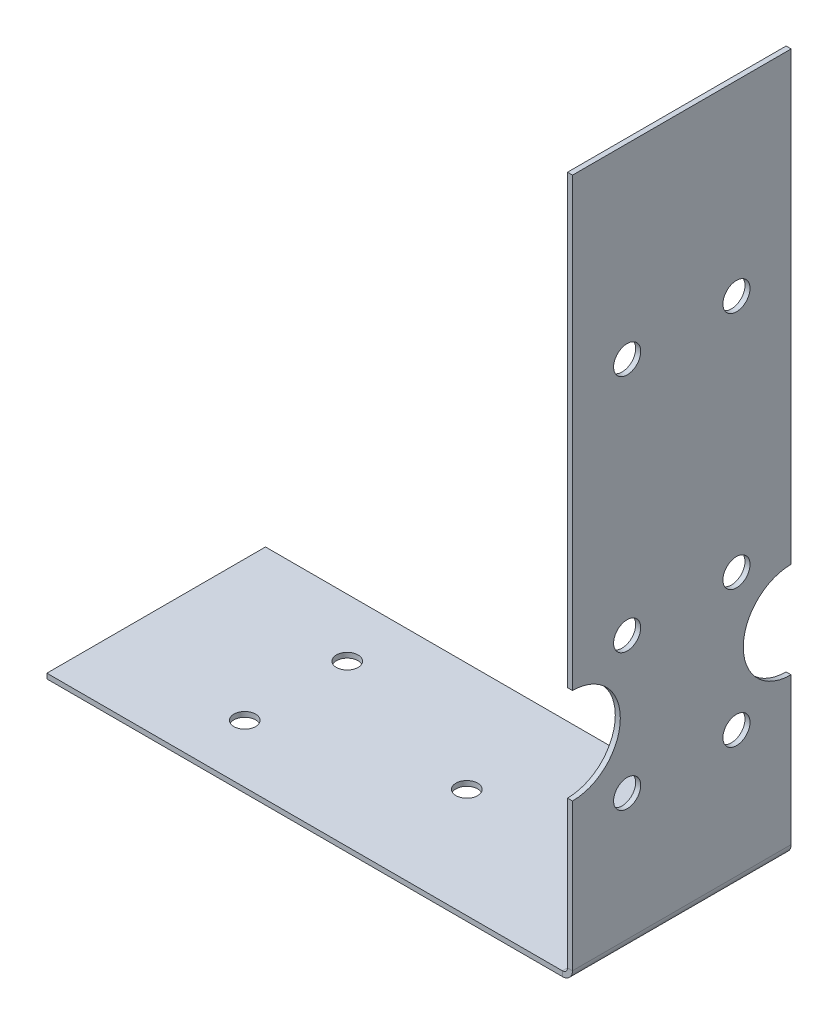
from build123d import *

# Parameters (mm, degrees)
BASE_FLANGE1_DEPTH = 16
SKETCH6_R          = 7
SKETCH6_R_2        = 1.984375
CUT_EXTRUDE1_DEPTH = 10
SKETCH7_R          = 1.5875
CUT_EXTRUDE2_DEPTH = 10


# Sheet-metal steps are written as plain solids
with BuildPart() as part:
    # Sketch1 → Base-Flange1 (new, symmetric)
    with BuildSketch(Plane.XY):
        with BuildLine():
            Line((-76.2, 0), (-0.7366, 0))
            ThreePointArc((-0.7366, 0), (-0.215745145, 0.215745145), (0, 0.7366))
            Line((0, 0.7366), (0, 101.6))
            Line((0, 101.6), (0.7366, 101.6))
            Line((0.7366, 101.6), (0.7366, 0.7366))
            ThreePointArc((0.7366, 0.7366), (0.30510971, -0.30510971), (-0.7366, -0.7366))
            Line((-0.7366, -0.7366), (-76.2, -0.7366))
            Line((-76.2, -0.7366), (-76.2, 0))
        make_face()
    extrude(amount=BASE_FLANGE1_DEPTH, both=True)

    # Sketch6 → Cut-Extrude1 (cut)
    with BuildSketch(Plane.ZY):
        with Locations((16, 29.2634)):
            Circle(SKETCH6_R)
        with Locations((8, 19.2634)):
            Circle(SKETCH6_R_2)
        with Locations((8, 39.2634)):
            Circle(SKETCH6_R_2)
        with Locations((8, 74.2634)):
            Circle(SKETCH6_R_2)
        with Locations((-8, 19.2634)):
            Circle(SKETCH6_R_2)
        with Locations((-16, 29.2634)):
            Circle(SKETCH6_R)
        with Locations((-8, 39.2634)):
            Circle(SKETCH6_R_2)
        with Locations((-8, 74.2634)):
            Circle(SKETCH6_R_2)
    extrude(amount=-CUT_EXTRUDE1_DEPTH, mode=Mode.SUBTRACT)

    # Sketch7 → Cut-Extrude2 (cut)
    with BuildSketch(Plane(origin=(0, 0, 0), x_dir=(1, 0, 0), z_dir=(0, 1, 0))):
        with Locations(Location((-30.7366, 0, 0), (0, 0, 270))):
            Circle(SKETCH7_R)
        with Locations(Location((-55.7366, -7.5, 0), (0, 0, 270))):
            Circle(SKETCH7_R)
        with Locations(Location((-55.7366, 7.5, 0), (0, 0, 270))):
            Circle(SKETCH7_R)
    extrude(amount=-CUT_EXTRUDE2_DEPTH, mode=Mode.SUBTRACT)


solid = part.part
